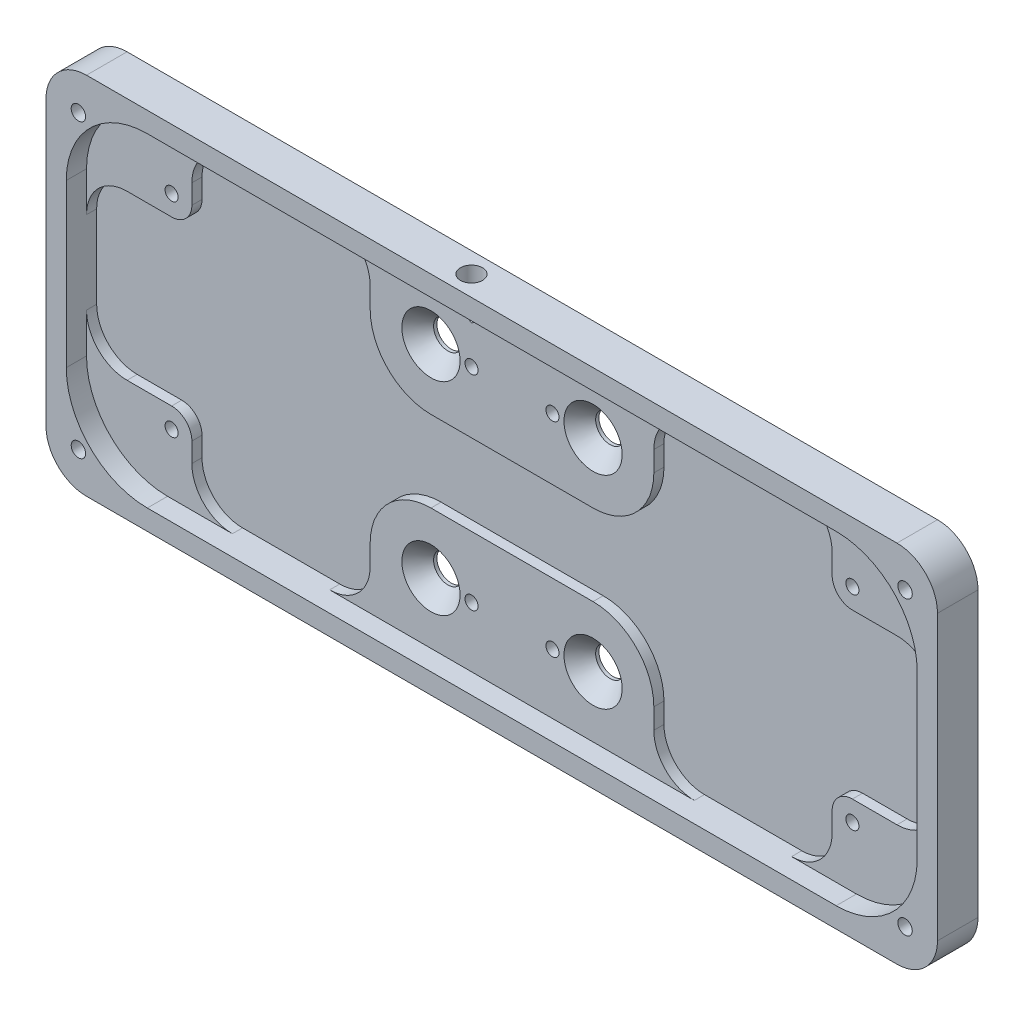
from build123d import *

# Parameters (mm, degrees)
SKETCH1_W                                     = 139.7
SKETCH1_H                                     = 57.15
BOSS_EXTRUDE1_DEPTH                           = 3.175
SKETCH2_W                                     = 133.35
SKETCH2_H                                     = 50.8
CUT_EXTRUDE1_DEPTH                            = 3.175
FILLET1_R                                     = 12.7
FILLET2_R                                     = 6.35
M2_5X0_45_TAPPED_HOLE1_D                      = 2.05
CSK_FOR_8_FLAT_HEAD_SOCKET_CAP_SCREW1_A_COUNT = 2
CSK_FOR_8_FLAT_HEAD_SOCKET_CAP_SCREW1_A_PITCH = 25.4
CSK_FOR_8_FLAT_HEAD_SOCKET_CAP_SCRE_2_COUNT   = 2
CSK_FOR_8_FLAT_HEAD_SOCKET_CAP_SCRE_2_PITCH   = 31.75
CSK_FOR_8_FLAT_HEAD_SOCKET_CAP_SCRE_3_COUNT   = 2
CSK_FOR_8_FLAT_HEAD_SOCKET_CAP_SCRE_3_PITCH   = 40.659838908
F_4_40_TAPPED_HOLE1_D                         = 2.2606
F_4_40_TAPPED_HOLE1_DEPTH                     = 7.62
F_4_40_TAPPED_HOLE1_TIP                       = 0.679152758
CUT_EXTRUDE2_START                            = -1.5875
CUT_EXTRUDE2_DEPTH                            = 1.5875
MIRROR2_START                                 = -1.5875
MIRROR2_COPY_1_DEPTH                          = 1.5875
FILLET3_R                                     = 6.35
F_8_32_TAPPED_HOLE1_D                         = 3.4544
F_8_32_TAPPED_HOLE1_DEPTH                     = 5.588
F_8_32_TAPPED_HOLE1_TIP                       = 1.037806461


with BuildPart() as part:
    # Sketch1 → Boss-Extrude1 (new, symmetric)
    with BuildSketch(Plane.XY):
        Rectangle(SKETCH1_W, SKETCH1_H)
    extrude(amount=BOSS_EXTRUDE1_DEPTH, both=True)

    # Sketch2 → Cut-Extrude1 (cut)
    with BuildSketch(Plane.XY.offset(3.175)):
        Rectangle(SKETCH2_W, SKETCH2_H)
    extrude(amount=-CUT_EXTRUDE1_DEPTH, mode=Mode.SUBTRACT)

    # Fillet1
    fillet1_edges = [part.edges().sort_by_distance(p)[0] for p in [
        (66.675, -25.4, 1.5875),
        (-66.675, -25.4, 1.5875),
        (-66.675, 25.4, 1.5875),
        (66.675, 25.4, 1.5875),
    ]]
    fillet(fillet1_edges, radius=FILLET1_R)

    # Fillet2
    fillet2_edges = [part.edges().sort_by_distance(p)[0] for p in [
        (69.85, -28.575, 0),
        (-69.85, -28.575, 0),
        (-69.85, 28.575, 0),
        (69.85, 28.575, 0),
    ]]
    fillet(fillet2_edges, radius=FILLET2_R)

    # M2.5x0.45 Tapped Hole1 (through all)
    with Locations(Plane.XY):
        with Locations((-53.34, -16), (-53.34, 16), (-6.34, 16), (-6.34, -16), (6.34, 16), (6.34, -16), (53.34, 16), (53.34, -16)):
            Hole(M2_5X0_45_TAPPED_HOLE1_D / 2)

    # Sketch10 → CSK for #8 Flat Head Socket Cap Screw1 (revolve, cut)
    with BuildSketch(Plane(origin=(-12.7, 15.875, 0), x_dir=(0, -1, 0), z_dir=(1, 0, 0))):
        Polygon((0, 0), (0, 3.175), (2.2479, 3.175), (2.2479, 2.658961536), (4.5593, 0), align=None)
    csk_for_8_flat_head_socket_cap_screw1 = revolve(axis=Axis((-12.7, 15.875, 6.35), (0, 0, -1)), mode=Mode.SUBTRACT)

    # CSK for #8 Flat Head Socket Cap Screw1 a: CSK for #8 Flat Head Socket Cap Screw1 ×2
    with Locations(*[(i * CSK_FOR_8_FLAT_HEAD_SOCKET_CAP_SCREW1_A_PITCH, 0, 0) for i in range(1, CSK_FOR_8_FLAT_HEAD_SOCKET_CAP_SCREW1_A_COUNT)]):
        add(csk_for_8_flat_head_socket_cap_screw1, mode=Mode.SUBTRACT)

    # CSK for _8 Flat Head Socket Cap Scre 2: CSK for #8 Flat Head Socket Cap Screw1 ×2
    with Locations(*[(0, -i * CSK_FOR_8_FLAT_HEAD_SOCKET_CAP_SCRE_2_PITCH, 0) for i in range(1, CSK_FOR_8_FLAT_HEAD_SOCKET_CAP_SCRE_2_COUNT)]):
        add(csk_for_8_flat_head_socket_cap_screw1, mode=Mode.SUBTRACT)

    # CSK for _8 Flat Head Socket Cap Scre 3: CSK for #8 Flat Head Socket Cap Screw1 ×2
    with Locations(*[Vector(0.6246950475544243, -0.7808688094430304, 0) * (i * CSK_FOR_8_FLAT_HEAD_SOCKET_CAP_SCRE_3_PITCH) for i in range(1, CSK_FOR_8_FLAT_HEAD_SOCKET_CAP_SCRE_3_COUNT)]):
        add(csk_for_8_flat_head_socket_cap_screw1, mode=Mode.SUBTRACT)

    # #4-40 Tapped Hole1
    with Locations(Plane.XY.offset(3.175)):
        with Locations((-64.77, 22.86), (-64.77, -22.86), (64.77, 22.86), (64.77, -22.86)):
            Hole(F_4_40_TAPPED_HOLE1_D / 2, depth=F_4_40_TAPPED_HOLE1_DEPTH)
            with Locations((0, 0, -(F_4_40_TAPPED_HOLE1_DEPTH + F_4_40_TAPPED_HOLE1_TIP / 2))):  # 118° drill point
                Cone(0, F_4_40_TAPPED_HOLE1_D / 2, F_4_40_TAPPED_HOLE1_TIP, mode=Mode.SUBTRACT)

    # Sketch14 → Cut-Extrude2 (cut)
    with BuildSketch(Plane.XY.offset(CUT_EXTRUDE2_START)):
        with BuildLine():
            Line((-22.225, 15.875), (-22.225, 25.4))
            Line((-22.225, 25.4), (-50.165, 25.4))
            Line((-50.165, 25.4), (-50.165, 16))
            ThreePointArc((-50.165, 16), (-51.09493597, 13.75493597), (-53.34, 12.825))
            Line((-53.34, 12.825), (-66.674384828, 12.825))
            ThreePointArc((-66.674384828, 12.825), (-66.674846206, 12.762500757), (-66.675, 12.7))
            Line((-66.675, 12.7), (-66.675, 0))
            Line((-66.675, 0), (0, 0))
            Line((0, 0), (0, 6.35))
            Line((0, 6.35), (-12.7, 6.35))
            ThreePointArc((-12.7, 6.35), (-19.435192091, 9.139807909), (-22.225, 15.875))
        make_face()
    cut_extrude2 = extrude(amount=CUT_EXTRUDE2_DEPTH, mode=Mode.SUBTRACT)

    # Mirror1: Cut-Extrude2 across plane
    add(cut_extrude2.mirror(Plane.ZX), mode=Mode.SUBTRACT)

    # Mirror2: Cut-Extrude2 across plane
    add(cut_extrude2.mirror(Plane(origin=(0, 0, 0), x_dir=(0, 0, 1), z_dir=(1, 0, 0))), mode=Mode.SUBTRACT)

    # Mirror2 copy 1 sketch → Mirror2 copy 1 (cut)
    with BuildSketch(Plane(origin=(0, 0, 0), x_dir=(-1, 0, 0), z_dir=(0, 0, 1)).offset(MIRROR2_START)):
        with BuildLine():
            Line((-22.225, 15.875), (-22.225, 25.4))
            Line((-22.225, 25.4), (-50.165, 25.4))
            Line((-50.165, 25.4), (-50.165, 16))
            ThreePointArc((-50.165, 16), (-51.09493597, 13.75493597), (-53.34, 12.825))
            Line((-53.34, 12.825), (-66.674384828, 12.825))
            ThreePointArc((-66.674384828, 12.825), (-66.674846206, 12.762500757), (-66.675, 12.7))
            Line((-66.675, 12.7), (-66.675, 0))
            Line((-66.675, 0), (0, 0))
            Line((0, 0), (0, 6.35))
            Line((0, 6.35), (-12.7, 6.35))
            ThreePointArc((-12.7, 6.35), (-19.435192091, 9.139807909), (-22.225, 15.875))
        make_face()
    extrude(amount=MIRROR2_COPY_1_DEPTH, mode=Mode.SUBTRACT)

    # Fillet3
    # the kernel refuses this fillet: 6.35 mm, written as the material it adds along each edge
    with BuildSketch(Plane(origin=(50.165, -25.4, -1.5875), x_dir=(0, 1, 0), z_dir=(0, 0, 1)), Plane(origin=(22.225, 25.4, -1.5875), x_dir=(0, -1, 0), z_dir=(0, 0, 1)), Plane(origin=(-22.225, -25.4, -1.5875), x_dir=(0, 1, 0), z_dir=(0, 0, 1)), Plane(origin=(-50.165, 25.4, -1.5875), x_dir=(0, -1, 0), z_dir=(0, 0, 1))) as fillet3_piece_1:
        with BuildLine():
            CenterArc((FILLET3_R, FILLET3_R), FILLET3_R, 180, 90)
            Line((0, FILLET3_R), (0, 0))
            Line((0, 0), (FILLET3_R, 0))
        make_face()
    extrude(amount=1.5875)
    with BuildSketch(Plane(origin=(66.674384828, -12.825, -1.5875), x_dir=(-1, 0, 0), z_dir=(0, 0, 1)), Plane(origin=(-66.674384828, 12.825, -1.5875), x_dir=(1, 0, 0), z_dir=(0, 0, 1))) as fillet3_piece_2:
        with BuildLine():
            CenterArc((6.349384828, -6.35), FILLET3_R, 90, 90)
            Line((-0.000615172, -6.35), (-0.635615172, -6.35))
            ThreePointArc((-0.635615172, -6.35), (-0.635615172, -0.125), (-0.634969241, 0.00625))
            Line((-0.634969241, 0.00625), (0, 0.635))
            Line((0, 0.635), (6.349384828, 0.635))
            Line((6.349384828, 0.635), (6.349384828, 0))
        make_face()
    extrude(amount=1.5875)
    with BuildSketch(Plane(origin=(66.674384828, 12.825, -1.5875), x_dir=(-1, 0, 0), z_dir=(0, 0, 1)), Plane(origin=(-66.674384828, -12.825, -1.5875), x_dir=(1, 0, 0), z_dir=(0, 0, 1))) as fillet3_piece_3:
        with BuildLine():
            CenterArc((6.349384828, 6.35), FILLET3_R, 180, 90)
            Line((-0.000615172, 6.35), (-0.635615172, 6.35))
            ThreePointArc((-0.635615172, 6.35), (-0.635615172, 0.125), (-0.634969241, -0.00625))
            Line((-0.634969241, -0.00625), (0, -0.635))
            Line((0, -0.635), (6.349384828, -0.635))
            Line((6.349384828, -0.635), (6.349384828, 0))
        make_face()
    extrude(amount=1.5875)
    with BuildSketch(Plane(origin=(50.165, 25.4, -1.5875), x_dir=(0, -1, 0), z_dir=(0, 0, 1)), Plane(origin=(22.225, -25.4, -1.5875), x_dir=(0, 1, 0), z_dir=(0, 0, 1)), Plane(origin=(-50.165, -25.4, -1.5875), x_dir=(0, 1, 0), z_dir=(0, 0, 1)), Plane(origin=(-22.225, 25.4, -1.5875), x_dir=(0, -1, 0), z_dir=(0, 0, 1))) as fillet3_piece_4:
        with BuildLine():
            CenterArc((FILLET3_R, -FILLET3_R), FILLET3_R, 90, 90)
            Line((0, -FILLET3_R), (0, 0))
            Line((0, 0), (FILLET3_R, 0))
        make_face()
    extrude(amount=1.5875)

    # #8-32 Tapped Hole1
    with Locations(Plane(origin=(0, 28.575, 0), x_dir=(-1, 0, 0), z_dir=(0, 1, 0))):
        with Locations((6.35, 0)):
            Hole(F_8_32_TAPPED_HOLE1_D / 2, depth=F_8_32_TAPPED_HOLE1_DEPTH)
            with Locations((0, 0, -(F_8_32_TAPPED_HOLE1_DEPTH + F_8_32_TAPPED_HOLE1_TIP / 2))):  # 118° drill point
                Cone(0, F_8_32_TAPPED_HOLE1_D / 2, F_8_32_TAPPED_HOLE1_TIP, mode=Mode.SUBTRACT)


solid = part.part
